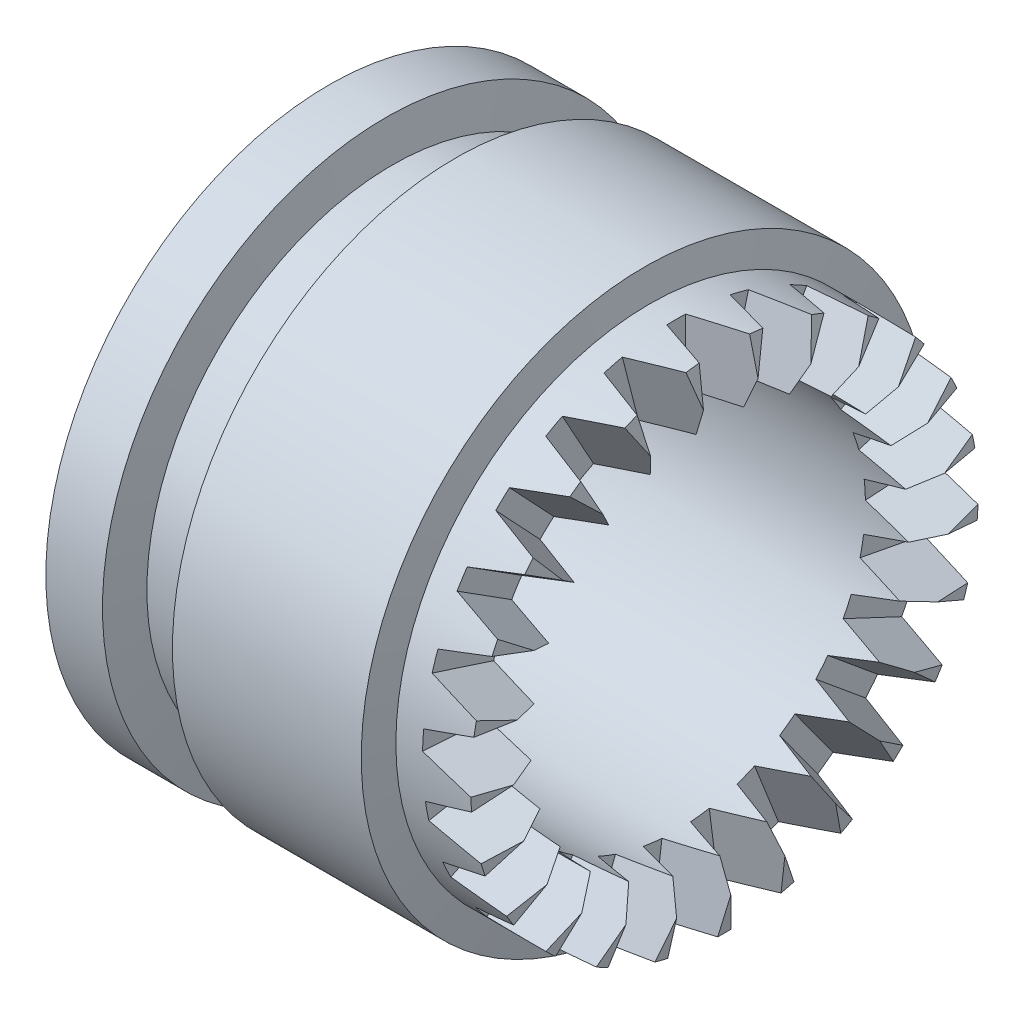
from build123d import *

# Parameters (mm, degrees)
SKETCH2_R          = 10.01706609
CUT_EXTRUDE1_DEPTH = 19
SKETCH3_R          = 12.417561257
CUT_EXTRUDE3_DEPTH = 3
CUT_EXTRUDE4_DEPTH = 4
CIRPATTERN1_COUNT  = 25


with BuildPart() as part:
    # Sketch1 → Revolve1 (revolve)
    with BuildSketch(Plane.XY):
        Polygon((-31.694782465, 0), (-53.694782465, 0), (-53.694782465, 12.417561257), (-53.239428838, 15), (-50.239428838, 15), (-49.886774877, 13), (-46.886774877, 13), (-46.534120916, 15), (-36.534120916, 15), (-36.259242944, 13.44108956), (-32.298530185, 13.44108956), (-31.694782465, 10.01706609), align=None)
    revolve(axis=Axis((-31.694782465, 0, 0), (-1, 0, 0)))

    # Sketch2 → Cut-Extrude1 (cut)
    with BuildSketch(Plane(origin=(-31.694782465, 0, 0), x_dir=(0, 0, -1), z_dir=(1, 0, 0))):
        Circle(SKETCH2_R)
    extrude(amount=-CUT_EXTRUDE1_DEPTH, mode=Mode.SUBTRACT)

    # Sketch3 → Cut-Extrude3 (cut)
    with BuildSketch(Plane.ZY.offset(53.694782465)):
        Circle(SKETCH3_R)
    extrude(amount=-CUT_EXTRUDE3_DEPTH, mode=Mode.SUBTRACT)

    # Sketch10 → Cut-Extrude4 (cut)
    with BuildSketch(Plane(origin=(-36.259242944, 13.44108956, 0), x_dir=(1, 0, 0), z_dir=(0, 1, 0))):
        Polygon((1.410443645, 0.5), (4.56446048, 1.531871829), (4.56446048, -1.531871829), (1.410443645, -0.5), align=None)
    cut_extrude4 = extrude(amount=-CUT_EXTRUDE4_DEPTH, mode=Mode.SUBTRACT)

    # CirPattern1: Cut-Extrude4 ×25 about axis
    cirpattern1_axis = Axis((-31.694782465, 0, 0), (-1, 0, 0))
    for i in range(1, CIRPATTERN1_COUNT):
        add(cut_extrude4.rotate(cirpattern1_axis, i * 360 / CIRPATTERN1_COUNT), mode=Mode.SUBTRACT)


solid = part.part
